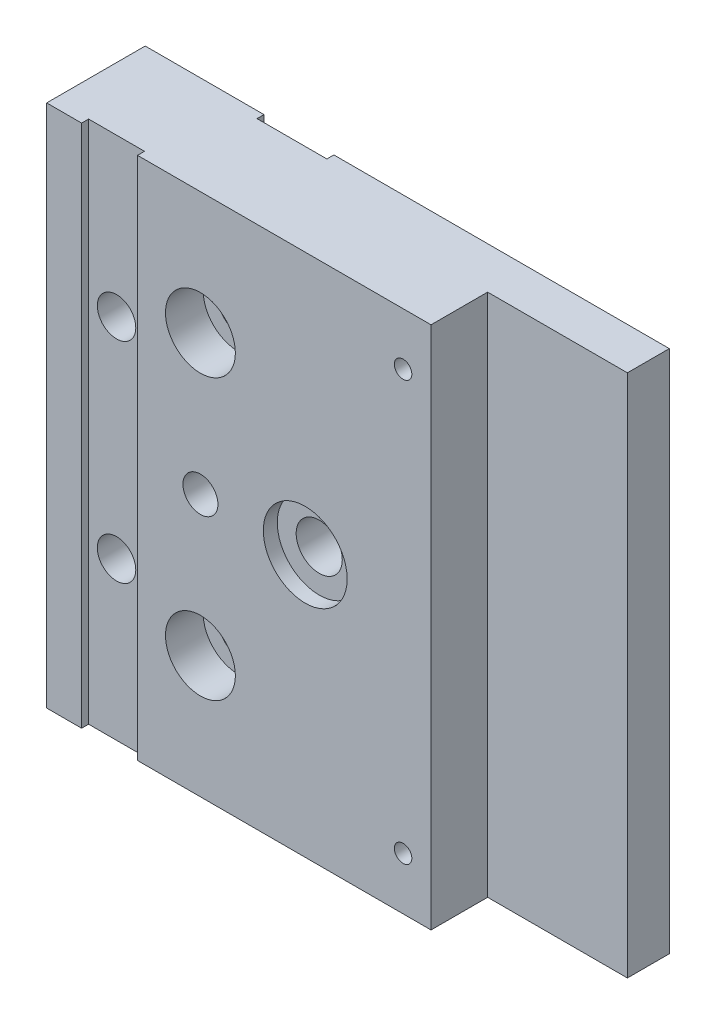
from build123d import *

# Parameters (mm, degrees)
SKETCH_1_W                   = 20
SKETCH_1_H                   = 75
EXTRUDE_1_DEPTH              = 6
SKETCH_2_W                   = 6
SKETCH_2_H                   = 75
EXTRUDE_2_DEPTH              = 20
SKETCH_3_W                   = 20
SKETCH_3_H                   = 75
EXTRUDE_3_DEPTH              = 8.1
SKETCH_4_W                   = 14.1
SKETCH_4_H                   = 75
EXTRUDE_4_DEPTH              = 35
HOLE_WIZARD_M6_1_D           = 6.6
HOLE_WIZARD_M6_1_CBORE_D     = 11
HOLE_WIZARD_M6_1_CBORE_DEPTH = 6.4
SKETCH_9_R                   = 6
CUT_EXTRUDE_1_DEPTH          = 2
HOLE_WIZARD_M3_1_D           = 2.5
HOLE_WIZARD_M3_1_DEPTH       = 10.1
HOLE_WIZARD_M3_1_TIP         = 0.751075774
SKETCH_15_W                  = 8
SKETCH_15_H                  = 75
CUT_EXTRUDE_3_DEPTH          = 1
HOLE_WIZARD_M5_1_D           = 5.5
HOLE_WIZARD_M5_1_CBORE_D     = 10
HOLE_WIZARD_M5_1_CBORE_DEPTH = 5.4
HOLE_WIZARD_M6_1_2_D         = 5
HOLE_WIZARD_M6_1_2_DEPTH     = 15
HOLE_WIZARD_M6_1_2_TIP       = 1.502151548
HOLE_WIZARD_M5_2_D           = 5.5
HOLE_WIZARD_M5_2_CBORE_D     = 10
HOLE_WIZARD_M5_2_CBORE_DEPTH = 5.4
SKETCH_24_W                  = 10
SKETCH_24_H                  = 75
CUT_EXTRUDE_4_DEPTH          = 1


with BuildPart() as part:
    # 草图1 → 凸台-拉伸1 (new body)
    with BuildSketch(Plane.XY):
        with Locations((10, 37.5)):
            Rectangle(SKETCH_1_W, SKETCH_1_H)
    extrude(amount=EXTRUDE_1_DEPTH)

    # 草图2 → 凸台-拉伸2 (add)
    with BuildSketch(Plane.ZY):
        with Locations((3, 37.5)):
            Rectangle(SKETCH_2_W, SKETCH_2_H)
    extrude(amount=EXTRUDE_2_DEPTH)

    # 草图3 → 凸台-拉伸3 (add)
    with BuildSketch(Plane.XY.offset(6)):
        with Locations((-10, 37.5)):
            Rectangle(SKETCH_3_W, SKETCH_3_H)
    extrude(amount=EXTRUDE_3_DEPTH)

    # 草图4 → 凸台-拉伸4 (add)
    with BuildSketch(Plane.ZY.offset(20)):
        with Locations((7.05, 37.5)):
            Rectangle(SKETCH_4_W, SKETCH_4_H)
    extrude(amount=EXTRUDE_4_DEPTH)

    # Hole Wizard M6 _1 (through all)
    with Locations(Plane(origin=(0, 0, 0), x_dir=(-1, 0, 0), z_dir=(0, 0, -1))):
        with Locations((18, 37.5)):
            CounterBoreHole(HOLE_WIZARD_M6_1_D / 2, HOLE_WIZARD_M6_1_CBORE_D / 2, HOLE_WIZARD_M6_1_CBORE_DEPTH)

    # 草图9 → 切除-拉伸1 (cut)
    with BuildSketch(Plane.XY.offset(14.1)):
        with Locations((-18, 37.5)):
            Circle(SKETCH_9_R)
    extrude(amount=-CUT_EXTRUDE_1_DEPTH, mode=Mode.SUBTRACT)

    # M3 螺纹孔1
    with Locations(Plane.XY.offset(14.1)):
        with Locations((-4, 7.5), (-4, 67.5)):
            Hole(HOLE_WIZARD_M3_1_D / 2, depth=HOLE_WIZARD_M3_1_DEPTH)
            with Locations((0, 0, -(HOLE_WIZARD_M3_1_DEPTH + HOLE_WIZARD_M3_1_TIP / 2))):  # 118° drill point
                Cone(0, HOLE_WIZARD_M3_1_D / 2, HOLE_WIZARD_M3_1_TIP, mode=Mode.SUBTRACT)

    # 草图15 → 切除-拉伸3 (cut)
    with BuildSketch(Plane.XY.offset(14.1)):
        with Locations((-46, 37.5)):
            Rectangle(SKETCH_15_W, SKETCH_15_H)
    extrude(amount=-CUT_EXTRUDE_3_DEPTH, mode=Mode.SUBTRACT)

    # M5 六角凹头螺钉的柱形沉头孔1 (through all)
    with Locations(Plane(origin=(0, 0, 0), x_dir=(-1, 0, 0), z_dir=(0, 0, -1))):
        with Locations((46, 52.5), (46, 22.5)):
            CounterBoreHole(HOLE_WIZARD_M5_1_D / 2, HOLE_WIZARD_M5_1_CBORE_D / 2, HOLE_WIZARD_M5_1_CBORE_DEPTH)

    # Hole Wizard M6 _1 2
    with Locations(Plane.XY.offset(14.1)):
        with Locations((-33, 37.5)):
            Hole(HOLE_WIZARD_M6_1_2_D / 2, depth=HOLE_WIZARD_M6_1_2_DEPTH)
            with Locations((0, 0, -(HOLE_WIZARD_M6_1_2_DEPTH + HOLE_WIZARD_M6_1_2_TIP / 2))):  # 118° drill point
                Cone(0, HOLE_WIZARD_M6_1_2_D / 2, HOLE_WIZARD_M6_1_2_TIP, mode=Mode.SUBTRACT)

    # M5 六角凹头螺钉的柱形沉头孔2 (through all)
    with Locations(Plane.XY.offset(14.1)):
        with Locations((-33, 57.5), (-33, 17.5)):
            CounterBoreHole(HOLE_WIZARD_M5_2_D / 2, HOLE_WIZARD_M5_2_CBORE_D / 2, HOLE_WIZARD_M5_2_CBORE_DEPTH)

    # 草图24 → 切除-拉伸4 (cut)
    with BuildSketch(Plane(origin=(0, 0, 0), x_dir=(-1, 0, 0), z_dir=(0, 0, -1))):
        with Locations((33, 37.5)):
            Rectangle(SKETCH_24_W, SKETCH_24_H)
    extrude(amount=-CUT_EXTRUDE_4_DEPTH, mode=Mode.SUBTRACT)


solid = part.part
